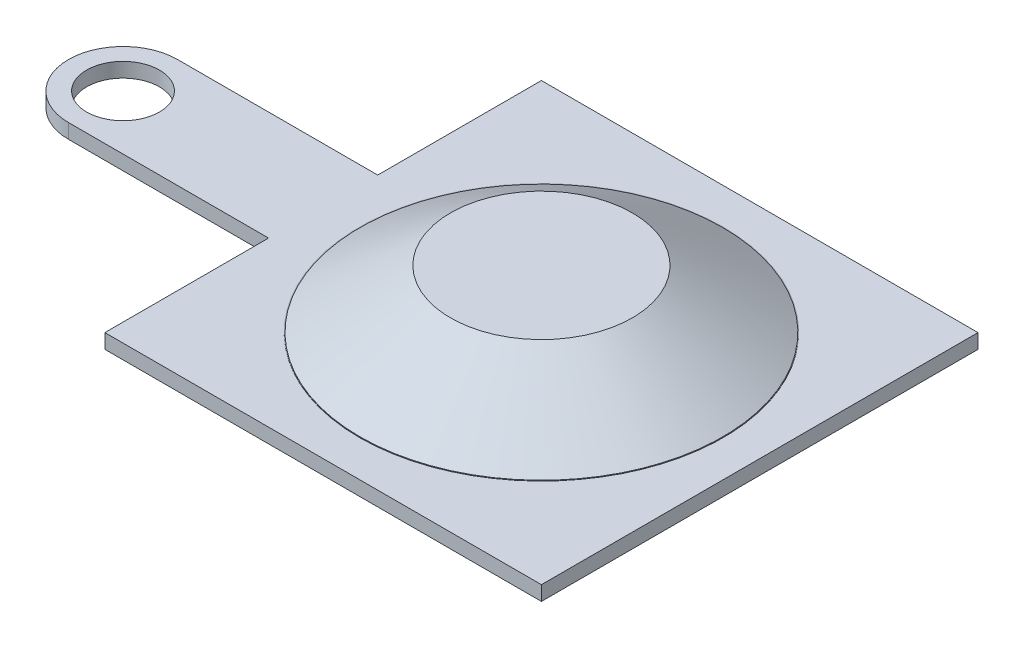
from build123d import *

# Parameters (mm, degrees)
SKETCH_1_W      = 12
SKETCH_1_H      = 12
SKETCH_1_W_2    = 7
SKETCH_1_H_2    = 3
SKETCH_1_R      = 1
EXTRUDE_1_DEPTH = 0.4
EXTRUDE_START   = 0.4
SKETCH_1_5_R    = 2.5
EXTRUDE_2_DEPTH = 1.6
SKETCH_1_6_R    = 5
EXTRUDE_3_DEPTH = 0.01
FILLET_1_R      = 1.5


with BuildPart() as part:
    # 草图1 → 凸台-拉伸1 (new body)
    # profile 1 of 2: a face of its own
    with BuildSketch(Plane(origin=(0, 0, 0), x_dir=(1, 0, 0), z_dir=(0, 1, 0))):
        Rectangle(SKETCH_1_W, SKETCH_1_H)
    # profile 2 of 2: a face of its own
    with BuildSketch(Plane(origin=(0, 0, 0), x_dir=(1, 0, 0), z_dir=(0, 1, 0))):
        with Locations((-9.5, 0)):
            Rectangle(SKETCH_1_W_2, SKETCH_1_H_2)
        with Locations(Location((-11.5, 0, 0), (0, 0, 270))):
            Circle(SKETCH_1_R, mode=Mode.SUBTRACT)
    extrude(amount=EXTRUDE_1_DEPTH)

    # 草图1<5> → 凸台-拉伸2 (add)
    with BuildSketch(Plane(origin=(0, 0, 0), x_dir=(1, 0, 0), z_dir=(0, 1, 0)).offset(EXTRUDE_START)):
        with Locations(Location((0, 0, 0), (0, 0, 90))):
            Circle(SKETCH_1_5_R)
    extrude(amount=EXTRUDE_2_DEPTH)

    # 草图1<6> → 凸台-拉伸3 (add)
    with BuildSketch(Plane(origin=(0, 0, 0), x_dir=(1, 0, 0), z_dir=(0, 1, 0)).offset(EXTRUDE_START)):
        with Locations(Location((0, 0, 0), (0, 0, 90))):
            Circle(SKETCH_1_6_R)
    extrude(amount=EXTRUDE_3_DEPTH)

    # loft up to a face of the part (loft_1)
    loft([Face(Wire([part.edges().sort_by_distance((-1.822421569, 2, 1.711367765))[0]])), Face(Wire([part.edges().sort_by_distance((-3.644843137, 0.4, 3.42273553))[0]]))])

    # 圆角1
    fillet_1_edges = [part.edges().sort_by_distance(p)[0] for p in [
        (-13, 0.2, 1.5),
        (-13, 0.2, -1.5),
    ]]
    fillet(fillet_1_edges, radius=FILLET_1_R - 0.0001)  # a hair under: the kernel refuses the full size


solid = part.part
